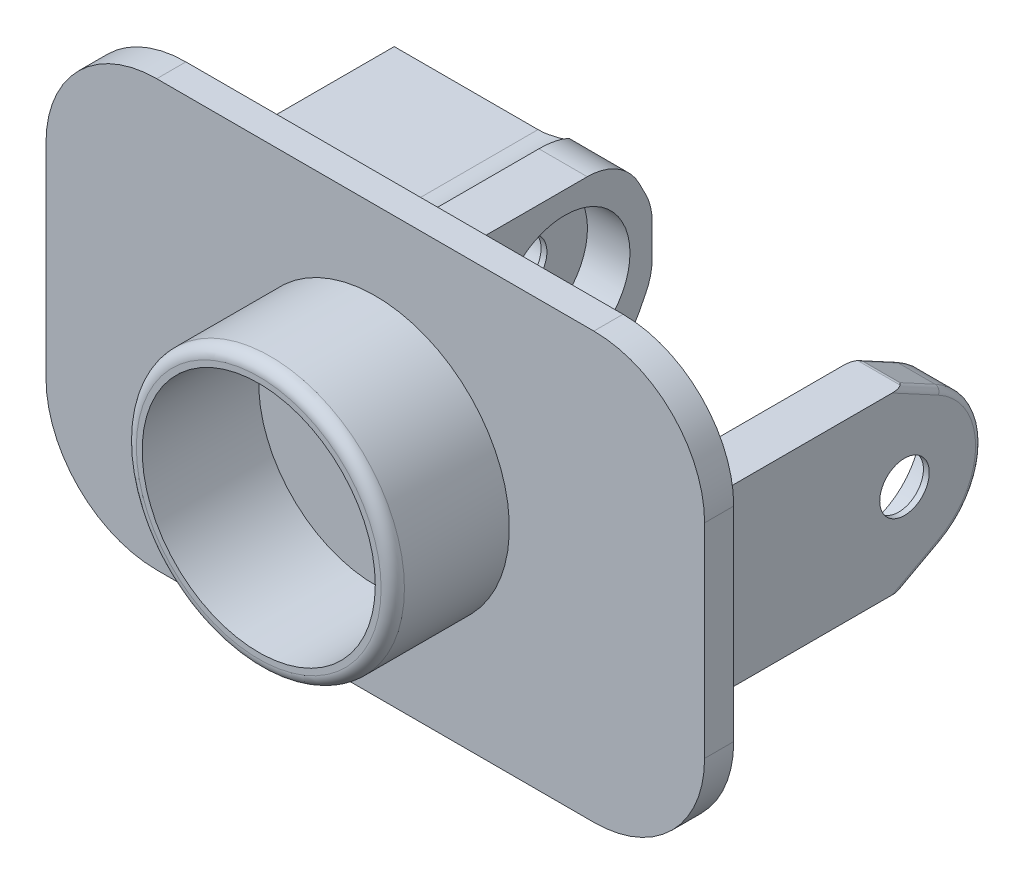
from build123d import *
from OCP.BRepAlgoAPI import BRepAlgoAPI_Cut
from OCP.TopTools import TopTools_ListOfShape

# Parameters (mm, degrees)
CROQUIS2_W               = 75
CROQUIS2_H               = 115
SALIENTE_EXTRUIR1_DEPTH  = 5
CROQUIS3_W               = 8.3
CROQUIS3_H               = 30
SALIENTE_EXTRUIR2_DEPTH  = 35
SALIENTE_EXTRUIR4_DEPTH  = 8.3
REDONDEO4_R              = 1
CORTAR_EXTRUIR1_DEPTH    = 118.172906425
CROQUIS3_3_W             = 8.3
CROQUIS3_3_H             = 30
SALIENTE_EXTRUIR6_DEPTH  = 50
CROQUIS8_R               = 11.2
CORTAR_EXTRUIR2_DEPTH    = 97.328292832
SALIENTE_EXTRUIR9_START  = -1
CROQUIS14_R              = 11.2
CROQUIS14_R_2            = 4.25
SALIENTE_EXTRUIR9_DEPTH  = 1
CROQUIS15_R              = 11.2
CROQUIS15_R_2            = 4.25
SALIENTE_EXTRUIR10_DEPTH = 1
CROQUIS9_W               = 17.2
CROQUIS9_H               = 37
CROQUIS9_W_2             = 13.2
CROQUIS9_H_2             = 33
SALIENTE_EXTRUIR11_DEPTH = 34
CROQUIS9_5_W             = 13.2
CROQUIS9_5_H             = 33
SALIENTE_EXTRUIR12_DEPTH = 7.5
CROQUIS16_W              = 13.2
CROQUIS16_H              = 4.85
CROQUIS16_R              = 0.85
SALIENTE_EXTRUIR13_DEPTH = 1.7
CROQUIS16_3_R            = 0.85
SALIENTE_EXTRUIR14_DEPTH = 6
REDONDEO5_R              = 0.5
CORTAR_EXTRUIR3_DEPTH    = 2
CROQUIS17_4_W            = 3
CROQUIS17_4_H            = 1
CORTAR_EXTRUIR4_DEPTH    = 35
REDONDEO6_R              = 10
CHAFL_N1_START           = -15.000000634
CHAFL_N1_DEPTH           = 30.000000634
CHAFL_N1_START_2         = -11.05
CHAFL_N1_2_DEPTH         = 11.05
CHAFL_N2_SIZE            = 5
CHAFL_N2_SIZE_2          = 9.813052528
CHAFL_N3_SIZE            = 9.813052528
CHAFL_N3_SIZE_2          = 5
REDONDEO7_R              = 10
REDONDEO8_R              = 10
REDONDEO9_R              = 20
SKETCH3_R                = 23
SKETCH3_R_2              = 20
BOSS_EXTRUDE1_DEPTH      = 20
CUT_EXTRUDE1_DEPTH       = 20
FILLET1_R                = 2


with BuildPart() as part:
    # Croquis2 → Saliente-Extruir1 (new body)
    with BuildSketch(Plane(origin=(0, 0, 0), x_dir=(0, 1, 0), z_dir=(0, 0, 1))):
        with Locations((0, 17.5)):
            Rectangle(CROQUIS2_W, CROQUIS2_H)
    extrude(amount=SALIENTE_EXTRUIR1_DEPTH)

    # Croquis3 → Saliente-Extruir2 (add)
    with BuildSketch(Plane(origin=(0, 0, 0), x_dir=(1, 0, 0), z_dir=(0, 0, -1))):
        with Locations((29.15, 0)):
            Rectangle(CROQUIS3_W, CROQUIS3_H)
    extrude(amount=SALIENTE_EXTRUIR2_DEPTH)

    # Croquis4 → Saliente-Extruir4 (add)
    with BuildSketch(Plane(origin=(25, 0, 0), x_dir=(0, -1, 0), z_dir=(-1, 0, 0))):
        with BuildLine():
            Line((11.616, -41.269652622), (15, -35))
            Line((15, -35), (11.2, -35))
            ThreePointArc((11.2, -35), (0, -46.2), (-11.2, -35))
            Line((-11.2, -35), (-15, -35))
            Line((-15, -35), (-11.616, -41.269652622))
            ThreePointArc((-11.616, -41.269652622), (0, -48.2), (11.616, -41.269652622))
        make_face()
    extrude(amount=-SALIENTE_EXTRUIR4_DEPTH)

    # Redondeo4
    redondeo4_edges = [part.edges().sort_by_distance(p)[0] for p in [
        (29.15, -15, -35),
        (29.15, 15, -35),
        (25, -13.308, -38.134826311),
        (33.3, 0, -48.2),
        (25, 13.308, -38.134826311),
        (25, 0, -48.2),
        (33.3, -13.308, -38.134826311),
        (33.3, 13.308, -38.134826311),
    ]]
    fillet(redondeo4_edges, radius=REDONDEO4_R)

    # Croquis4<6> → Cortar-Extruir1 (cut, through all)
    with BuildSketch(Plane(origin=(25, 0, 0), x_dir=(0, -1, 0), z_dir=(-1, 0, 0))):
        with BuildLine():
            ThreePointArc((-11.2, -35), (0, -46.2), (11.2, -35))
            Line((11.2, -35), (-11.2, -35))
        make_face()
        with BuildLine():
            Line((-11.2, -35), (11.2, -35))
            ThreePointArc((11.2, -35), (0, -23.8), (-11.2, -35))
        make_face()
    extrude(amount=-CORTAR_EXTRUIR1_DEPTH, mode=Mode.SUBTRACT)

    # Croquis3<3> → Saliente-Extruir6 (add)
    with BuildSketch(Plane(origin=(0, 0, 0), x_dir=(1, 0, 0), z_dir=(0, 0, -1))):
        with Locations((-29.15, 0)):
            Rectangle(CROQUIS3_3_W, CROQUIS3_3_H)
    extrude(amount=SALIENTE_EXTRUIR6_DEPTH)

    # Croquis8 → Cortar-Extruir2 (cut, through all)
    with BuildSketch(Plane(origin=(-33.3, 0, 0), x_dir=(0, -1, 0), z_dir=(-1, 0, 0))):
        with Locations(Location((0, -35, 0), (0, 0, 90))):
            Circle(CROQUIS8_R)
    extrude(amount=-CORTAR_EXTRUIR2_DEPTH, mode=Mode.SUBTRACT)

    # Croquis14 → Saliente-Extruir9 (add)
    with BuildSketch(Plane.YZ.offset(33.3).offset(SALIENTE_EXTRUIR9_START)):
        with Locations(Location((0, -35, 0), (0, 0, 90))):
            Circle(CROQUIS14_R)
        with Locations((0, -35)):
            Circle(CROQUIS14_R_2, mode=Mode.SUBTRACT)
    extrude(amount=SALIENTE_EXTRUIR9_DEPTH)

    # Croquis15 → Saliente-Extruir10 (add)
    with BuildSketch(Plane(origin=(-33.3, 0, 0), x_dir=(0, -1, 0), z_dir=(-1, 0, 0))):
        with Locations((0, -35)):
            Circle(CROQUIS15_R)
        with Locations(Location((0, -35, 0), (0, 0, 180))):
            Circle(CROQUIS15_R_2, mode=Mode.SUBTRACT)
    extrude(amount=-SALIENTE_EXTRUIR10_DEPTH)

    # Croquis9 → Saliente-Extruir11 (add)
    with BuildSketch(Plane(origin=(-33.3, 0, 0), x_dir=(0, -1, 0), z_dir=(-1, 0, 0))):
        with Locations((0, -29.55)):
            Rectangle(CROQUIS9_W, CROQUIS9_H)
        with Locations((0, -29.55)):
            Rectangle(CROQUIS9_W_2, CROQUIS9_H_2, mode=Mode.SUBTRACT)
    extrude(amount=SALIENTE_EXTRUIR11_DEPTH)

    # Croquis9<5> → Saliente-Extruir12 (add)
    with BuildSketch(Plane(origin=(-33.3, 0, 0), x_dir=(0, -1, 0), z_dir=(-1, 0, 0))):
        with Locations((0, -29.55)):
            Rectangle(CROQUIS9_5_W, CROQUIS9_5_H)
        with BuildLine():
            ThreePointArc((-2.9, -29.463530005), (0, -41.25), (2.9, -29.463530005))
            ThreePointArc((2.9, -29.463530005), (0, -26.85), (-2.9, -29.463530005))
        make_face(mode=Mode.SUBTRACT)
    extrude(amount=SALIENTE_EXTRUIR12_DEPTH)

    # Croquis16 → Saliente-Extruir13 (add)
    # profile 1 of 4: a face of its own
    with BuildSketch(Plane(origin=(-40.8, 0, 0), x_dir=(0, -1, 0), z_dir=(-1, 0, 0))):
        with Locations((0, -15.475)):
            Rectangle(CROQUIS16_W, CROQUIS16_H)
        with Locations((0, -15.9)):
            Circle(CROQUIS16_R, mode=Mode.SUBTRACT)
    # profile 2 of 4: a face of its own
    with BuildSketch(Plane(origin=(-40.8, 0, 0), x_dir=(0, -1, 0), z_dir=(-1, 0, 0))):
        with Locations((0, -15.9)):
            Circle(CROQUIS16_R)
    # profile 3 of 4: a face of its own
    with BuildSketch(Plane(origin=(-40.8, 0, 0), x_dir=(0, -1, 0), z_dir=(-1, 0, 0))):
        with BuildLine():
            Line((-0.788986692, -41.2), (-6.6, -41.2))
            Line((-6.6, -41.2), (-6.6, -46.05))
            Line((-6.6, -46.05), (6.6, -46.05))
            Line((6.6, -46.05), (6.6, -41.2))
            Line((6.6, -41.2), (0.788986692, -41.2))
            ThreePointArc((0.788986692, -41.2), (0, -41.25), (-0.788986692, -41.2))
        make_face()
        with Locations((0, -43.2)):
            Circle(CROQUIS16_R, mode=Mode.SUBTRACT)
    # profile 4 of 4: a face of its own
    with BuildSketch(Plane(origin=(-40.8, 0, 0), x_dir=(0, -1, 0), z_dir=(-1, 0, 0))):
        with Locations((0, -43.2)):
            Circle(CROQUIS16_R)
    extrude(amount=SALIENTE_EXTRUIR13_DEPTH)

    # Croquis16<3> → Saliente-Extruir14 (add)
    with BuildSketch(Plane(origin=(-40.8, 0, 0), x_dir=(0, -1, 0), z_dir=(-1, 0, 0))):
        with Locations((0, -15.9)):
            Circle(CROQUIS16_3_R)
        with Locations((0, -43.2)):
            Circle(CROQUIS16_3_R)
    extrude(amount=SALIENTE_EXTRUIR14_DEPTH)

    # Redondeo5
    redondeo5_edges = [part.edges().sort_by_distance(p)[0] for p in [
        (-42.5, 0.85, -15.9),
        (-46.8, 0.85, -15.9),
        (-42.5, 0.85, -43.2),
        (-46.8, 0.85, -43.2),
    ]]
    fillet(redondeo5_edges, radius=REDONDEO5_R)

    # Croquis17 → Cortar-Extruir3 (cut)
    with BuildSketch(Plane(origin=(0, 0, -48.05), x_dir=(1, 0, 0), z_dir=(0, 0, -1))):
        Polygon((-67.3, -6.6), (-62.3, -6.6), (-62.3, -3.5), (-57.3, -3.5), (-57.3, 3.5), (-62.3, 3.5), (-62.3, 6.6), (-67.3, 6.6), align=None)
    extrude(amount=-CORTAR_EXTRUIR3_DEPTH, mode=Mode.SUBTRACT)

    # Croquis17<4> → Cortar-Extruir4 (cut)
    with BuildSketch(Plane(origin=(0, 0, -48.05), x_dir=(1, 0, 0), z_dir=(0, 0, -1))):
        with Locations((-63.8, 7.1)):
            Rectangle(CROQUIS17_4_W, CROQUIS17_4_H)
        with Locations((-63.8, -7.1)):
            Rectangle(CROQUIS17_4_W, CROQUIS17_4_H)
    extrude(amount=-CORTAR_EXTRUIR4_DEPTH, mode=Mode.SUBTRACT)

    # Redondeo6
    # the kernel refuses this fillet: 10 mm, written as the material it adds along each edge
    with BuildSketch(Plane(origin=(-33.3, -8.6, -48.05), x_dir=(-1, 0, 0), z_dir=(0, 1, 0))) as redondeo6_piece_1:
        with BuildLine():
            CenterArc((5.932748098, -10), REDONDEO6_R, 90, 36.389744678)
            Line((0, -1.95), (0, 0))
            Line((0, 0), (5.932748098, 0))
        make_face()
    extrude(amount=17.2)
    with BuildSketch(Plane(origin=(-33.3, -8.6, -11.05), x_dir=(-1, 0, 0), z_dir=(0, 0, -1)), Plane(origin=(-33.3, 8.6, -48.05), x_dir=(-1, 0, 0), z_dir=(0, 0, 1))) as redondeo6_piece_2:
        with BuildLine():
            CenterArc((9.329523032, -10), REDONDEO6_R, 90, 68.899803976)
            Line((0, -6.4), (0, 0))
            Line((0, 0), (9.329523032, 0))
        make_face()
    extrude(amount=37)
    with BuildSketch(Plane(origin=(-33.3, -23.431870246, -48.05), x_dir=(-1, 0, 0), z_dir=(0, 1, 0))) as redondeo6_piece_3a_section:
        with BuildLine():
            CenterArc((5.932748098, -10), REDONDEO6_R, 90, 36.389744678)
            Line((0, -1.95), (0, 0))
            Line((0, 0), (5.932748098, 0))
        make_face()
    redondeo6_piece_3a = extrude(amount=32.031870246, mode=Mode.PRIVATE)
    redondeo6_piece_3a = split(redondeo6_piece_3a, bisect_by=Plane(origin=(-33.3, -8.6, -48.05), z_dir=(0, -1, 0)), keep=Keep.TOP, mode=Mode.PRIVATE)
    redondeo6_piece_3a = split(redondeo6_piece_3a, bisect_by=Plane(origin=(-33.3, -15, -48.05), z_dir=(0, 1, 0)), keep=Keep.TOP, mode=Mode.PRIVATE)
    with BuildSketch(Plane(origin=(-33.3, -8.6, -11.05), x_dir=(-1, 0, 0), z_dir=(0, 0, -1))) as redondeo6_piece_3b_section:
        with BuildLine():
            CenterArc((9.329523032, -10), REDONDEO6_R, 90, 68.899803976)
            Line((0, -6.4), (0, 0))
            Line((0, 0), (9.329523032, 0))
        make_face()
    redondeo6_piece_3b = extrude(amount=60.323807579, mode=Mode.PRIVATE)
    redondeo6_piece_3b = split(redondeo6_piece_3b, bisect_by=Plane(origin=(-33.3, -8.6, -48.05), z_dir=(0, 0, -1)), keep=Keep.TOP, mode=Mode.PRIVATE)
    redondeo6_piece_3b = split(redondeo6_piece_3b, bisect_by=Plane(origin=(-33.3, -8.6, -50), z_dir=(0, 0, 1)), keep=Keep.TOP, mode=Mode.PRIVATE)
    redondeo6_piece_3 = redondeo6_piece_3a & redondeo6_piece_3b
    add(redondeo6_piece_3)
    with BuildSketch(Plane(origin=(-33.3, -8.6, -48.05), x_dir=(-1, 0, 0), z_dir=(0, 1, 0))) as redondeo6_piece_4a_section:
        with BuildLine():
            CenterArc((5.932748098, -10), REDONDEO6_R, 90, 36.389744678)
            Line((0, -1.95), (0, 0))
            Line((0, 0), (5.932748098, 0))
        make_face()
    redondeo6_piece_4a = extrude(amount=32.031870246, mode=Mode.PRIVATE)
    redondeo6_piece_4a = split(redondeo6_piece_4a, bisect_by=Plane(origin=(-33.3, 8.6, -48.05), z_dir=(0, 1, 0)), keep=Keep.TOP, mode=Mode.PRIVATE)
    redondeo6_piece_4a = split(redondeo6_piece_4a, bisect_by=Plane(origin=(-33.3, 15, -48.05), z_dir=(0, -1, 0)), keep=Keep.TOP, mode=Mode.PRIVATE)
    with BuildSketch(Plane(origin=(-33.3, 8.6, -71.373807579), x_dir=(-1, 0, 0), z_dir=(0, 0, 1))) as redondeo6_piece_4b_section:
        with BuildLine():
            CenterArc((9.329523032, -10), REDONDEO6_R, 90, 68.899803976)
            Line((0, -6.4), (0, 0))
            Line((0, 0), (9.329523032, 0))
        make_face()
    redondeo6_piece_4b = extrude(amount=60.323807579, mode=Mode.PRIVATE)
    redondeo6_piece_4b = split(redondeo6_piece_4b, bisect_by=Plane(origin=(-33.3, 8.6, -48.05), z_dir=(0, 0, -1)), keep=Keep.TOP, mode=Mode.PRIVATE)
    redondeo6_piece_4b = split(redondeo6_piece_4b, bisect_by=Plane(origin=(-33.3, 8.6, -50), z_dir=(0, 0, 1)), keep=Keep.TOP, mode=Mode.PRIVATE)
    redondeo6_piece_4 = redondeo6_piece_4a & redondeo6_piece_4b
    add(redondeo6_piece_4)


with BuildPart() as chafl_n1_tool:
    # Chaflán1: read off the stored shape, not the designer's step
    # Chaflán1 outline → Chaflán1 (new body)
    with BuildSketch(Plane(origin=(0, 0, 0), x_dir=(1, 0, 0), z_dir=(0, 1, 0)).offset(CHAFL_N1_START)):
        Polygon((-53.3, 11.05), (-42.25, 0), (-33.3, 0), (-33.3, 11.05), align=None)
    extrude(amount=CHAFL_N1_DEPTH)


with BuildPart() as part_1:
    add(part.part)


with BuildPart() as part_2:
    # Chaflán1: joined with chafl_n1_tool
    add(part_1.part.fuse(chafl_n1_tool.part, tol=0.00001))


with BuildPart() as chafl_n1_2_tool:
    # Chafl_n1 2 outline → Chafl_n1 2 (new body)
    with BuildSketch(Plane.XY.offset(CHAFL_N1_START_2)):
        with BuildLine():
            Line((-55, 8.6), (-42.629523032, 8.6))
            ThreePointArc((-42.629523032, 8.6), (-36.972668782, 10.353788749), (-33.3, 15))
            Line((-33.3, 15), (-55, 15))
            Line((-55, 15), (-55, 8.6))
        make_face()
        with BuildLine():
            Line((-42.629523032, -8.6), (-55, -8.6))
            Line((-55, -8.6), (-55, -15.000000634))
            Line((-55, -15.000000634), (-33.299999925, -15.000000195))
            ThreePointArc((-33.299999925, -15.000000195), (-36.972668696, -10.353788808), (-42.629523032, -8.6))
        make_face()
    extrude(amount=CHAFL_N1_2_DEPTH)


with BuildPart() as part_3:
    add(part_2.part)

    # Chafl_n1 2: cut by chafl_n1_2_tool, with a tolerance
    chafl_n1_2_stock = TopTools_ListOfShape()
    chafl_n1_2_stock.Append(part_3.part.wrapped)
    chafl_n1_2_tools = TopTools_ListOfShape()
    chafl_n1_2_tools.Append(chafl_n1_2_tool.part.wrapped)
    chafl_n1_2_cut = BRepAlgoAPI_Cut()
    chafl_n1_2_cut.SetArguments(chafl_n1_2_stock)
    chafl_n1_2_cut.SetTools(chafl_n1_2_tools)
    chafl_n1_2_cut.SetFuzzyValue(0.00001)
    chafl_n1_2_cut.Build()
    add(Compound.cast(chafl_n1_2_cut.Shape()).solids(), mode=Mode.REPLACE)

    # Chaflán2
    # the kernel refuses this chamfer: 9.813052528, 5 mm, written as the material it takes off along each edge
    with BuildSketch(Plane(origin=(-58.710886279, -15, -50), x_dir=(0, 0, 1), z_dir=(1, 0, 0))) as chafl_n2_piece_1:
        Polygon((CHAFL_N2_SIZE, 0), (0, -CHAFL_N2_SIZE_2), (0, 0), align=None)
    extrude(amount=59.121772559, mode=Mode.SUBTRACT)

    # Chaflán3
    # the kernel refuses this chamfer: 9.813052528, 5 mm, written as the material it takes off along each edge
    with BuildSketch(Plane(origin=(0.410886279, 15, -50), x_dir=(0, -1, 0), z_dir=(-1, 0, 0))) as chafl_n3_piece_1:
        Polygon((CHAFL_N3_SIZE, 0), (0, CHAFL_N3_SIZE_2), (0, 0), align=None)
    extrude(amount=59.121772559, mode=Mode.SUBTRACT)

    # Redondeo7
    redondeo7_edges = [part_3.edges().sort_by_distance(p)[0] for p in [
        (-29.15, 5.186947472, -50),
        (-29.15, -5.186947472, -50),
    ]]
    fillet(redondeo7_edges, radius=REDONDEO7_R)

    # Redondeo8
    redondeo8_edges = [part_3.edges().sort_by_distance(p)[0] for p in [
        (-29.15, 15, -45),
        (-29.15, -15, -45),
    ]]
    fillet(redondeo8_edges, radius=REDONDEO8_R)

    # Redondeo9
    redondeo9_edges = [part_3.edges().sort_by_distance(p)[0] for p in [
        (40, 37.5, 2.5),
        (40, -37.5, 2.5),
        (-75, -37.5, 2.5),
        (-75, 37.5, 2.5),
    ]]
    fillet(redondeo9_edges, radius=REDONDEO9_R)

    # Sketch3 → Boss-Extrude1 (add)
    with BuildSketch(Plane.XY.offset(5)):
        with Locations(Location((-17.5, 0, 0), (0, 0, 180))):
            Circle(SKETCH3_R)
        with Locations((-17.5, 0)):
            Circle(SKETCH3_R_2, mode=Mode.SUBTRACT)
    extrude(amount=BOSS_EXTRUDE1_DEPTH)

    # Sketch5 → Cut-Extrude1 (cut)
    with BuildSketch(Plane.XY.offset(5)):
        with BuildLine():
            Line((40, -17.5), (40, 17.5))
            ThreePointArc((40, 17.5), (34.142135624, 31.642135624), (20, 37.5))
            Line((20, 37.5), (-55, 37.5))
            ThreePointArc((-55, 37.5), (-69.142135624, 31.642135624), (-75, 17.5))
            Line((-75, 17.5), (-75, -17.5))
            ThreePointArc((-75, -17.5), (-69.142135624, -31.642135624), (-55, -37.5))
            Line((-55, -37.5), (20, -37.5))
            ThreePointArc((20, -37.5), (34.142135624, -31.642135624), (40, -17.5))
        make_face()
        with BuildLine():
            Line((20, 36.5), (-55, 36.5))
            ThreePointArc((-55, 36.5), (-68.435028843, 30.935028843), (-74, 17.5))
            Line((-74, 17.5), (-74, -17.5))
            ThreePointArc((-74, -17.5), (-68.435028843, -30.935028843), (-55, -36.5))
            Line((-55, -36.5), (20, -36.5))
            ThreePointArc((20, -36.5), (33.435028843, -30.935028843), (39, -17.5))
            Line((39, -17.5), (39, 17.5))
            ThreePointArc((39, 17.5), (33.435028843, 30.935028843), (20, 36.5))
        make_face(mode=Mode.SUBTRACT)
    extrude(amount=-CUT_EXTRUDE1_DEPTH, mode=Mode.SUBTRACT)

    # Fillet1
    fillet1_edges = [part_3.edges().sort_by_distance(p)[0] for p in [
        (5.5, 0, 25),
    ]]
    fillet(fillet1_edges, radius=FILLET1_R)


solid = part_3.part
